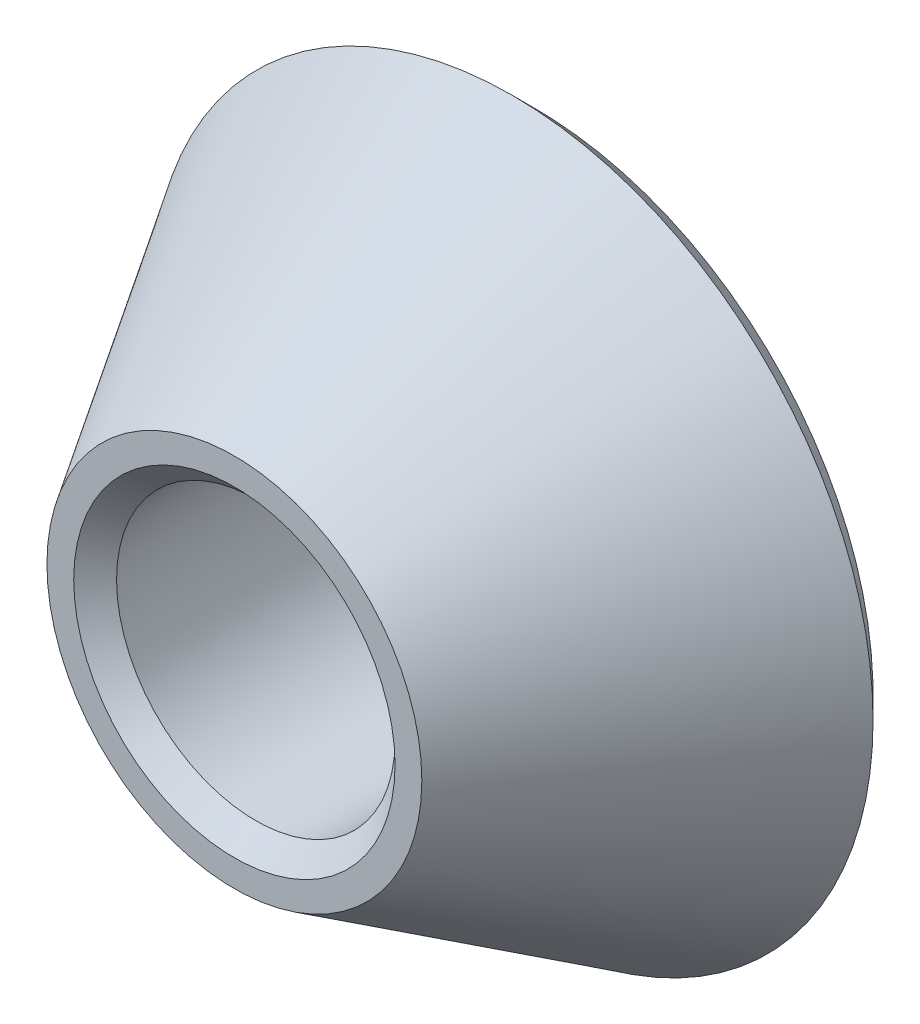
from build123d import *

# Parameters (mm, degrees)
FASE1_SIZE = 0.4


with BuildPart() as part:
    # Skizze5 → Rotation1 (revolve)
    with BuildSketch(Plane(origin=(0, 0, 0), x_dir=(0, 0, -1), z_dir=(1, 0, 0))):
        Polygon((0, 2.6), (-5.6, 2.6), (-5.6, 3.5), (-0.415050889, 6.740593194), (0, 6.325542305), align=None)
    revolve(axis=Axis((0, 0, 0), (0, 0, 1)))

    # Fase1
    fase1_edges = [part.edges().sort_by_distance(p)[0] for p in [
        (0, -2.6, 5.6),
        (0, -2.6, 0),
    ]]
    chamfer(fase1_edges, length=FASE1_SIZE)


solid = part.part
